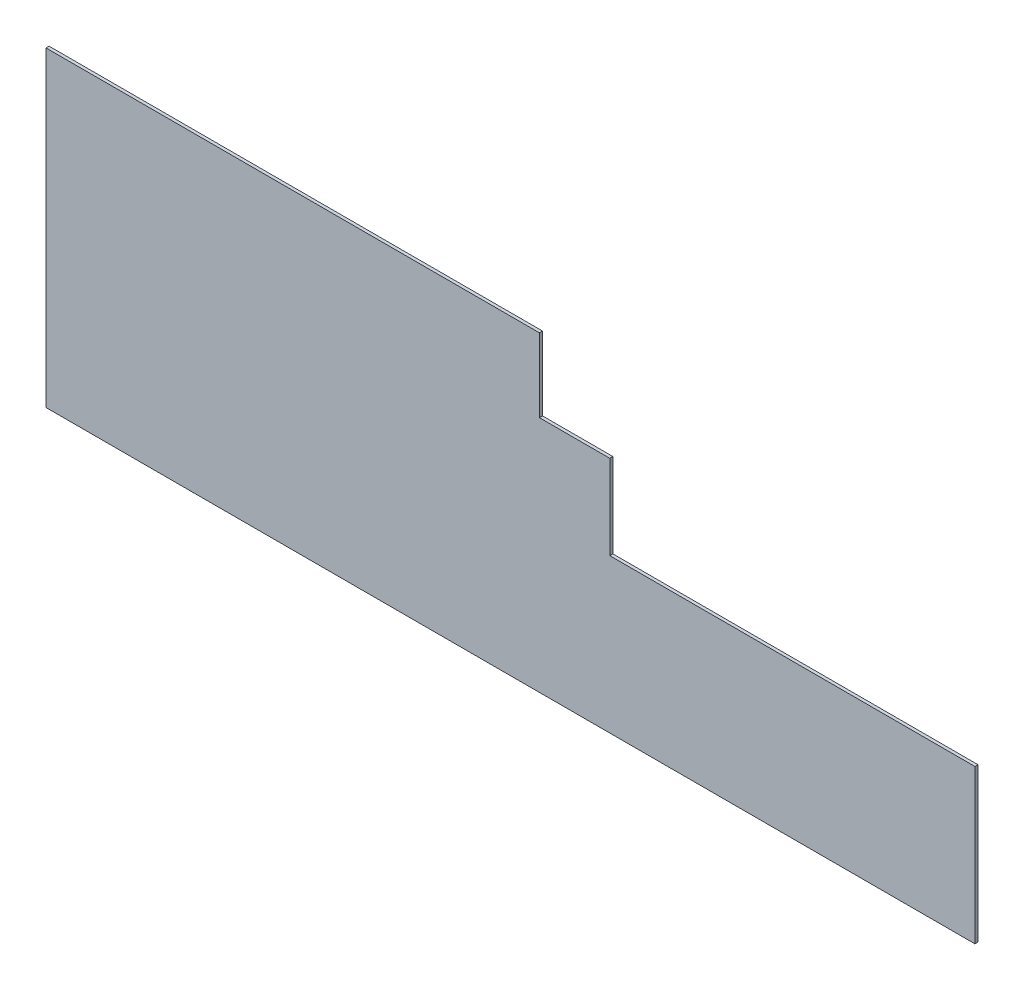
from build123d import *

# Parameters (mm, degrees)
TABAN_FLAN_1_DEPTH         = 20
KES_EKSTR_ZYON1_DEPTH      = 6333.502270035
KES_EKSTR_ZYON1_DEPTH_BACK = 6333.502270035
IZIM2_W                    = 2360
IZIM2_H                    = 545
IZIM2_W_2                  = 379
IZIM2_H_2                  = 206


# Sheet-metal steps are written as plain solids
with BuildPart() as part:
    # Çizim1 → Taban-Flanş1 (new body)
    with BuildSketch(Plane.XY):
        Polygon((0, 0), (0, 2013), (3568, 2013), (3568, 1807), (6004, 1807), (6004, 0), align=None)
    extrude(amount=-TABAN_FLAN_1_DEPTH)

    # Çizim2 → Kes-Ekstrüzyon1 (cut, two sides: drawn at the far end of the back side and taken through both)
    with BuildSketch(Plane.XY.offset(-KES_EKSTR_ZYON1_DEPTH_BACK)):
        with Locations((4824, 1265.5)):
            Rectangle(IZIM2_W, IZIM2_H)
        Polygon((6004, 1538), (6004, 1807), (3568, 1807), (3189, 1807), (3189, 1538), (3644, 1538), align=None)
        with Locations((3378.5, 1910)):
            Rectangle(IZIM2_W_2, IZIM2_H_2)
    extrude(amount=KES_EKSTR_ZYON1_DEPTH + KES_EKSTR_ZYON1_DEPTH_BACK, mode=Mode.SUBTRACT)


solid = part.part
